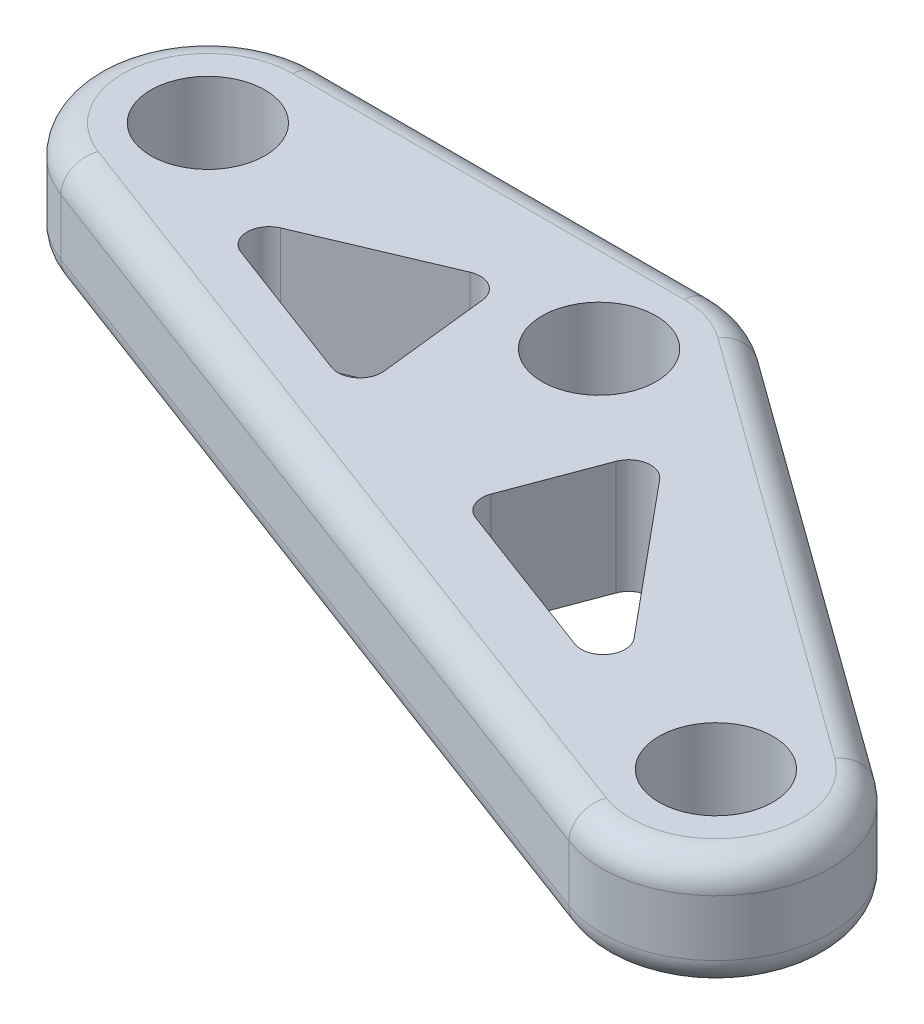
from build123d import *

# Parameters (mm, degrees)
SKETCH1_R           = 5
BOSS_EXTRUDE1_DEPTH = 10
FILLET1_R           = 2.54
SCALE1_SCALE        = 0.66
FILLET2_R           = 1.27


with BuildPart() as part:
    # Sketch1 → Boss-Extrude1 (new body)
    with BuildSketch(Plane(origin=(0, 0, 0), x_dir=(1, 0, 0), z_dir=(0, 1, 0))):
        with BuildLine():
            Line((-37.807044038, -9.361111111), (33.524622629, -36.160986681))
            ThreePointArc((33.524622629, -36.160986681), (45.851500304, -31.531347991), (42.90340673, -18.698023718))
            Line((42.90340673, -18.698023718), (5.861740063, 8.101851852))
            ThreePointArc((5.861740063, 8.101851852), (3.080704585, 9.513635439), (0, 10))
            Line((0, 10), (-34.29, 10))
            ThreePointArc((-34.29, 10), (-44.128981429, 1.787300882), (-37.807044038, -9.361111111))
        make_face()
        with Locations((-34.29, 0)):
            Circle(SKETCH1_R, mode=Mode.SUBTRACT)
        Circle(SKETCH1_R, mode=Mode.SUBTRACT)
        with Locations((37.041666667, -26.79987557)):
            Circle(SKETCH1_R, mode=Mode.SUBTRACT)
        Polygon((-7.373318213, -14.24424589), (-27.557795825, -6.660776812), (-9.089196081, 1.165091942), align=None, mode=Mode.SUBTRACT)
        Polygon((10.448030186, -4.7063742), (5.617045705, -17.564724), (28.147439019, -26.029572301), align=None, mode=Mode.SUBTRACT)
    extrude(amount=BOSS_EXTRUDE1_DEPTH)

    # Fillet1
    fillet1_edges = [part.edges().sort_by_distance(p)[0] for p in [
        (-44.128981429, 0, -1.787300882),
        (-17.145, 0, -10),
        (3.080704585, 0, -9.513635439),
        (24.382573397, 0, 5.298085933),
        (45.851500304, 0, 31.531347991),
        (-44.128981429, 10, -1.787300882),
        (-17.145, 10, -10),
        (3.080704585, 10, -9.513635439),
        (24.382573397, 10, 5.298085933),
        (45.851500304, 10, 31.531347991),
        (-2.141210705, 0, 22.761048896),
        (-2.141210705, 10, 22.761048896),
    ]]
    fillet(fillet1_edges, radius=FILLET1_R)


with BuildPart() as part_1:
    # Scale1: scaled about (2.327239798, 5, 10.366216283)
    add(part.part.scale(SCALE1_SCALE).moved(Location((0.791261531, 1.7, 3.524513536))))

    # Fillet2
    fillet2_edges = [part_1.edges().sort_by_distance(p)[0] for p in [
        (4.498511697, 5, 15.117231376),
        (7.686961454, 5, 6.630720508),
        (19.368571284, 5, 20.704031255),
        (-4.075128489, 5, 12.925715824),
        (-17.396883713, 5, 7.920626232),
        (-5.207607882, 5, 2.755552855),
    ]]
    fillet(fillet2_edges, radius=FILLET2_R)


solid = part_1.part
